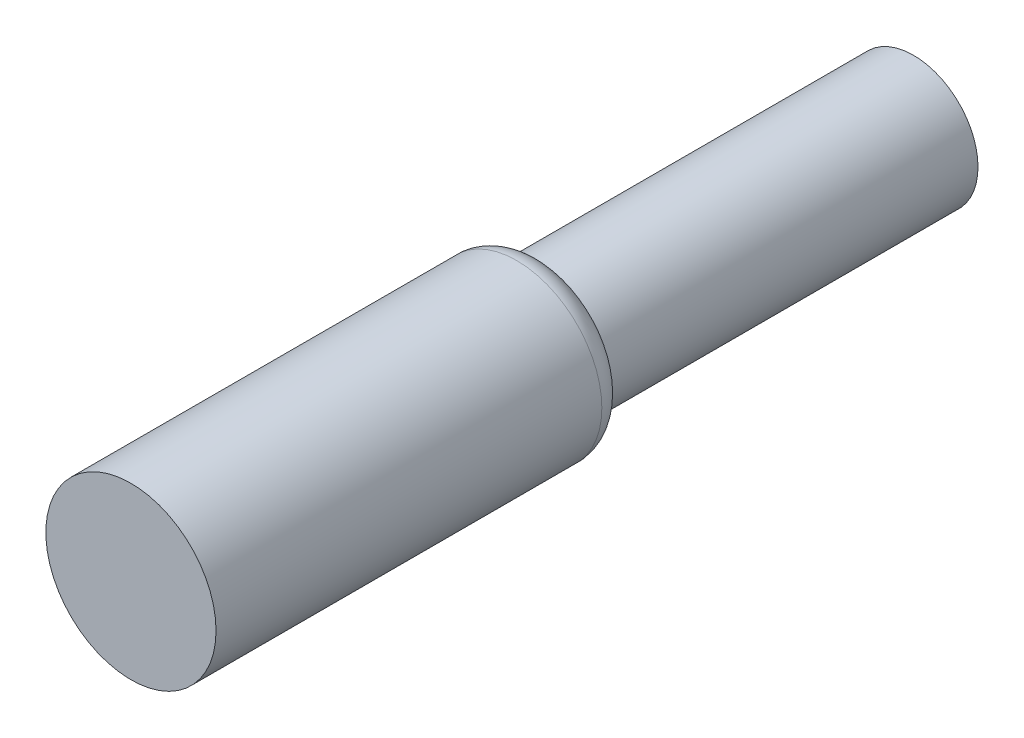
from build123d import *

# Parameters (mm, degrees)
FILLET2_R = 1


with BuildPart() as part:
    # Sketch1 → Revolve1 (revolve)
    with BuildSketch(Plane(origin=(0, 0, 0), x_dir=(1, 0, 0), z_dir=(0, 1, 0))):
        Polygon((2.48046875, 15.821969221), (3.27421875, 15.821969221), (3.27421875, 0), (0, 0), (0, 15.821969221), (0, 30.109469221), (2.48046875, 30.109469221), align=None)
    revolve(axis=Axis((0, 0, -15.821969221), (0, 0, -1)))

    # Fillet2
    # the kernel refuses this fillet: 1 mm, written as the material it takes off along each edge
    with BuildSketch(Plane(origin=(0, 0, -15.821969221), x_dir=(1, 0, 0), z_dir=(0, 1, 0))) as fillet2_piece_1:
        with BuildLine():
            CenterArc((2.27421875, -0.978499329), FILLET2_R, 0, 78.097317351)
            Line((3.27421875, -0.978499329), (3.29421875, -0.978499329))
            Line((3.29421875, -0.978499329), (3.29421875, 0))
            Line((3.29421875, 0), (3.27421875, 0.02))
            ThreePointArc((3.27421875, 0.02), (2.87734375, 0.02), (2.48459375, 0.019569987))
            Line((2.48459375, 0.019569987), (2.48046875, 0))
        make_face()
    revolve(axis=Axis((0, 0, -15.821969221), (0, 0, -1)), mode=Mode.SUBTRACT)


solid = part.part
